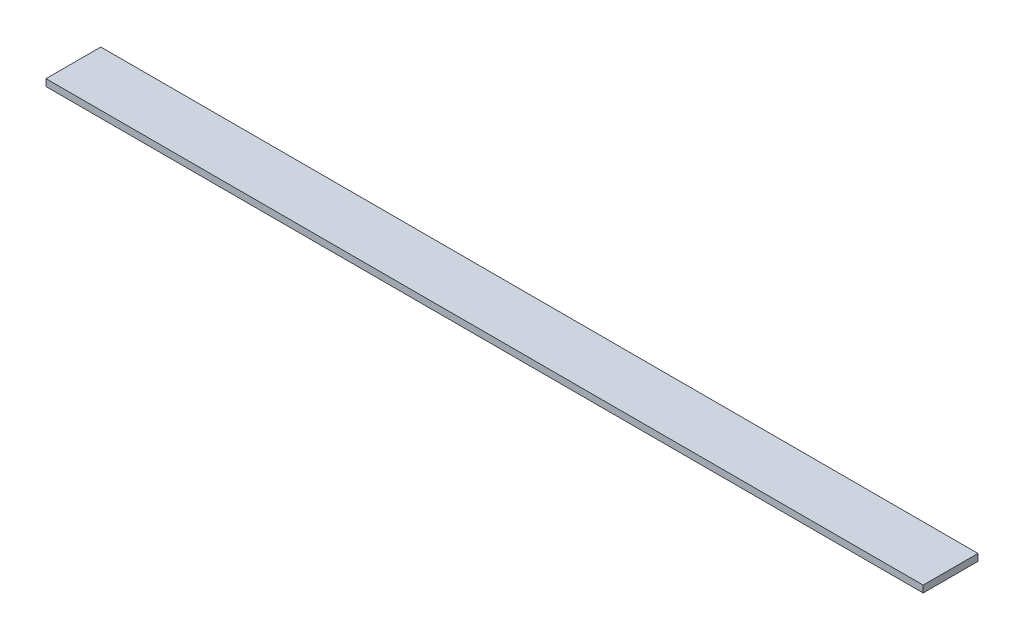
from build123d import *

# Parameters (mm, degrees)
SKETCH1_W          = 406.4
SKETCH1_H          = 25.4
BASE_FLANGE1_DEPTH = 3.175


# Sheet-metal steps are written as plain solids
with BuildPart() as part:
    # Sketch1 → Base-Flange1 (new body)
    with BuildSketch(Plane(origin=(0, 0, 0), x_dir=(1, 0, 0), z_dir=(0, 1, 0))):
        Rectangle(SKETCH1_W, SKETCH1_H)
    extrude(amount=-BASE_FLANGE1_DEPTH)


solid = part.part
